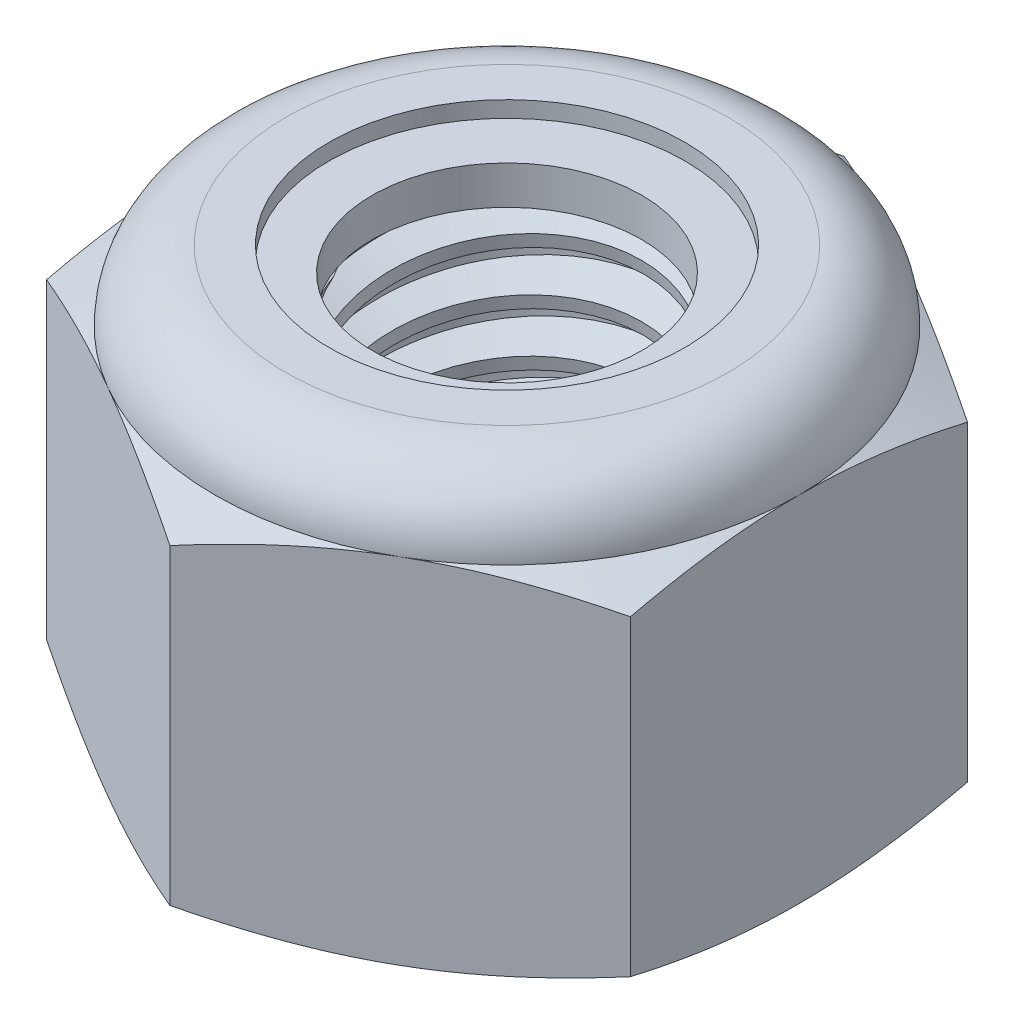
from build123d import *

# Parameters (mm, degrees)
EXTRUDE1_DEPTH       = 4
SKETCH2_W            = 1.5
SKETCH2_H            = 4
LPATTERN1_COUNT      = 8
LPATTERN1_PITCH      = 0.5
LPATTERN1_COUNT_DIR2 = 2
LPATTERN1_PITCH_DIR2 = 0.5


with BuildPart() as part:
    # Sketch1 → Extrude1 (new body)
    with BuildSketch(Plane(origin=(0, 0, 0), x_dir=(1, 0, 0), z_dir=(0, 1, 0))):
        Polygon((0, 3.175426481), (-2.75, 1.58771324), (-2.75, -1.58771324), (0, -3.175426481), (2.75, -1.58771324), (2.75, 1.58771324), align=None)
    extrude(amount=EXTRUDE1_DEPTH)

    # Sketch4 → Cut-Revolve2 (revolve, cut)
    with BuildSketch(Plane(origin=(0, 0, 0), x_dir=(0, 0, -1), z_dir=(1, 0, 0))):
        Polygon((0, 4), (1.5, 4), (1.269011592, 3.892288336), (1.269011592, 0.107711664), (1.5, 0), (0, 0), align=None)
    revolve(axis=Axis((0, 4, 0), (0, 1, 0)), mode=Mode.SUBTRACT)


with BuildPart() as body_2:
    # Sketch2 → Revolve1 (revolve)
    with BuildSketch(Plane(origin=(0, 0, 0), x_dir=(0, 0, -1), z_dir=(1, 0, 0))):
        with Locations((0.75, 2)):
            Rectangle(SKETCH2_W, SKETCH2_H)
    revolve(axis=Axis((0, -1.5, 0), (0, 1, 0)))

    # Sketch3 → Cut-Revolve1 (revolve, cut)
    with BuildSketch(Plane(origin=(0, 0, 0), x_dir=(0, 0, -1), z_dir=(1, 0, 0))):
        Polygon((1.510274937, 3.93835038), (1.582199494, 3.506803038), (1.289561466, 3.616435308), (1.269011592, 3.739734548), align=None)
    cut_revolve1 = revolve(axis=Axis((0, 4, 0.089188249), (0, -0.9863939238321436, -0.16439898730535793)), mode=Mode.SUBTRACT)

    # LPattern1: Cut-Revolve1 8 × 2
    with Locations(*[Vector(0, -1, 0) * (i * LPATTERN1_PITCH) + Vector(0, 1, 0) * (j * LPATTERN1_PITCH_DIR2) for i in range(LPATTERN1_COUNT) for j in range(LPATTERN1_COUNT_DIR2) if (i, j) != (0, 0)]):
        add(cut_revolve1, mode=Mode.SUBTRACT)


with BuildPart() as part_1:
    add(part.part)

    # Combine1: cut body 2
    add(body_2.part, mode=Mode.SUBTRACT)

    # Sketch5 → Cut-Revolve3 (revolve, cut)
    with BuildSketch(Plane(origin=(0, 0, 0), x_dir=(0, 0, -1), z_dir=(1, 0, 0))):
        with BuildLine():
            Line((0, 0), (2.75, 0))
            Line((2.75, 0), (3.175426481, 0.198379626))
            Line((3.175426481, 0.198379626), (3.175426481, 3.134953707))
            Line((3.175426481, 3.134953707), (2.75, 3.333333333))
            ThreePointArc((2.75, 3.333333333), (2.554737854, 3.804737854), (2.083333333, 4))
            Line((2.083333333, 4), (2.083333333, 5.27))
            Line((2.083333333, 5.27), (4.445426481, 5.27))
            Line((4.445426481, 5.27), (4.445426481, -1.27))
            Line((4.445426481, -1.27), (0, -1.27))
            Line((0, -1.27), (0, 0))
        make_face()
    revolve(axis=Axis((0, 0, 0), (0, 1, 0)), mode=Mode.SUBTRACT)

    # Sketch6 → Cut-Revolve4 (revolve, cut)
    with BuildSketch(Plane(origin=(0, 0, 0), x_dir=(0, 0, -1), z_dir=(1, 0, 0))):
        with BuildLine():
            Line((0, 3.333333333), (2.5976, 3.333333333))
            ThreePointArc((2.5976, 3.333333333), (2.446974781, 3.696974781), (2.083333333, 3.8476))
            Line((2.083333333, 3.8476), (1.676172463, 3.8476))
            Line((1.676172463, 3.8476), (1.676172463, 5.27))
            Line((1.676172463, 5.27), (0, 5.27))
            Line((0, 5.27), (0, 3.333333333))
        make_face()
    revolve(axis=Axis((0, 5.27, 0), (0, 1, 0)), mode=Mode.SUBTRACT)


with BuildPart() as body_2_2:
    # Sketch7 → Revolve2 (revolve)
    with BuildSketch(Plane(origin=(0, 0, 0), x_dir=(0, 0, -1), z_dir=(1, 0, 0))):
        with BuildLine():
            Line((1.269011592, 3.409533333), (2.514721748, 3.409533333))
            ThreePointArc((2.514721748, 3.409533333), (2.36486639, 3.668954462), (2.083333333, 3.7714))
            Line((2.083333333, 3.7714), (1.269011592, 3.7714))
            Line((1.269011592, 3.7714), (1.269011592, 3.409533333))
        make_face()
    revolve(axis=Axis((0, 3.409533333, 0), (0, 1, 0)))


solid = Compound([part_1.part, body_2_2.part])
